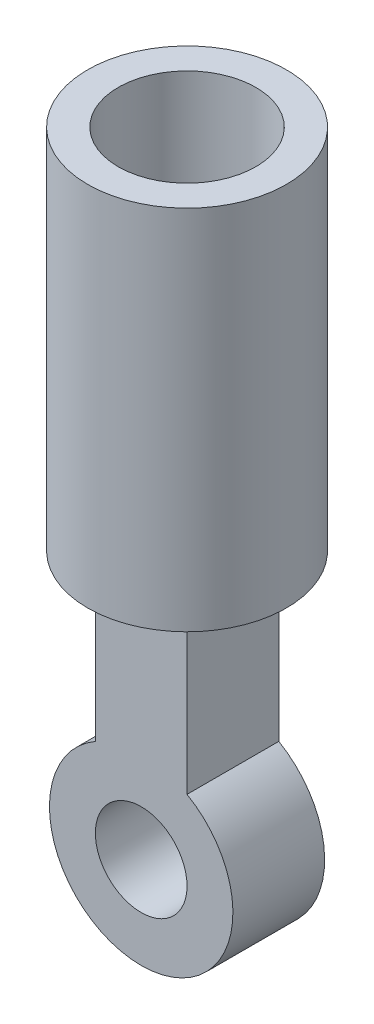
from build123d import *

# Parameters (mm, degrees)
CROQUIS1_R                   = 1.5
SALIENTE_EXTRUIR1_DEPTH      = 3
SALIENTE_EXTRUIR2_DEPTH      = 10
SALIENTE_EXTRUIR2_DEPTH_BACK = 2
CROQUIS2_R                   = 3.25
VACIADO1_T                   = -1


with BuildPart() as part:
    # Croquis1 → Saliente-Extruir1 (new body)
    with BuildSketch(Plane.XY):
        with BuildLine():
            Line((1.5, 10), (-1.5, 10))
            Line((-1.5, 10), (-1.5, 2.598076211))
            ThreePointArc((-1.5, 2.598076211), (0, -3), (1.5, 2.598076211))
            Line((1.5, 2.598076211), (1.5, 10))
        make_face()
        Circle(CROQUIS1_R, mode=Mode.SUBTRACT)
    extrude(amount=SALIENTE_EXTRUIR1_DEPTH)

    # Croquis2 → Saliente-Extruir2 (add, two sides: drawn at the far end of the back side and taken through both)
    with BuildSketch(Plane(origin=(0, 10, 0), x_dir=(1, 0, 0), z_dir=(0, 1, 0)).offset(-SALIENTE_EXTRUIR2_DEPTH_BACK)):
        with Locations((0, -1.5)):
            Circle(CROQUIS2_R)
    extrude(amount=SALIENTE_EXTRUIR2_DEPTH + SALIENTE_EXTRUIR2_DEPTH_BACK)

    # Vaciado1
    vaciado1_openings = [part.faces().sort_by_distance(p)[0] for p in [
        (0, 20, 1.5),
    ]]
    offset(amount=VACIADO1_T, openings=vaciado1_openings, kind=Kind.INTERSECTION)


solid = part.part
